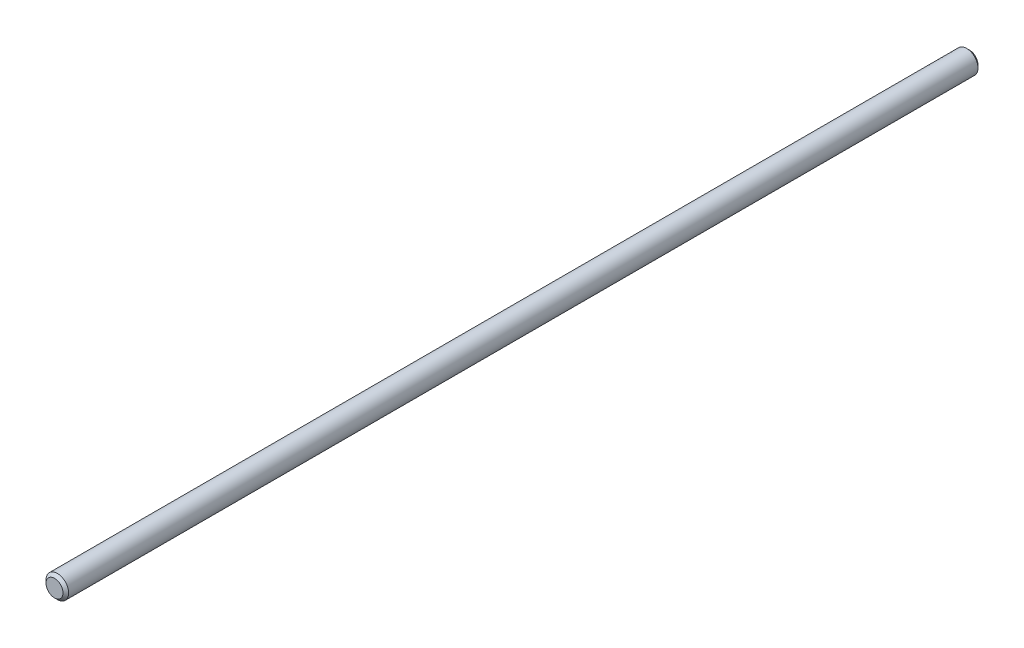
from build123d import *

# Parameters (mm, degrees)
SKETCH1_R           = 4
BOSS_EXTRUDE1_DEPTH = 323
CHAMFER1_SIZE       = 1


with BuildPart() as part:
    # Sketch1 → Boss-Extrude1 (new body)
    with BuildSketch(Plane.XY):
        Circle(SKETCH1_R)
    extrude(amount=BOSS_EXTRUDE1_DEPTH)

    # Chamfer1
    chamfer1_edges = [part.edges().sort_by_distance(p)[0] for p in [
        (-4, 0, 323),
        (-4, 0, 0),
    ]]
    chamfer(chamfer1_edges, length=CHAMFER1_SIZE)


solid = part.part
